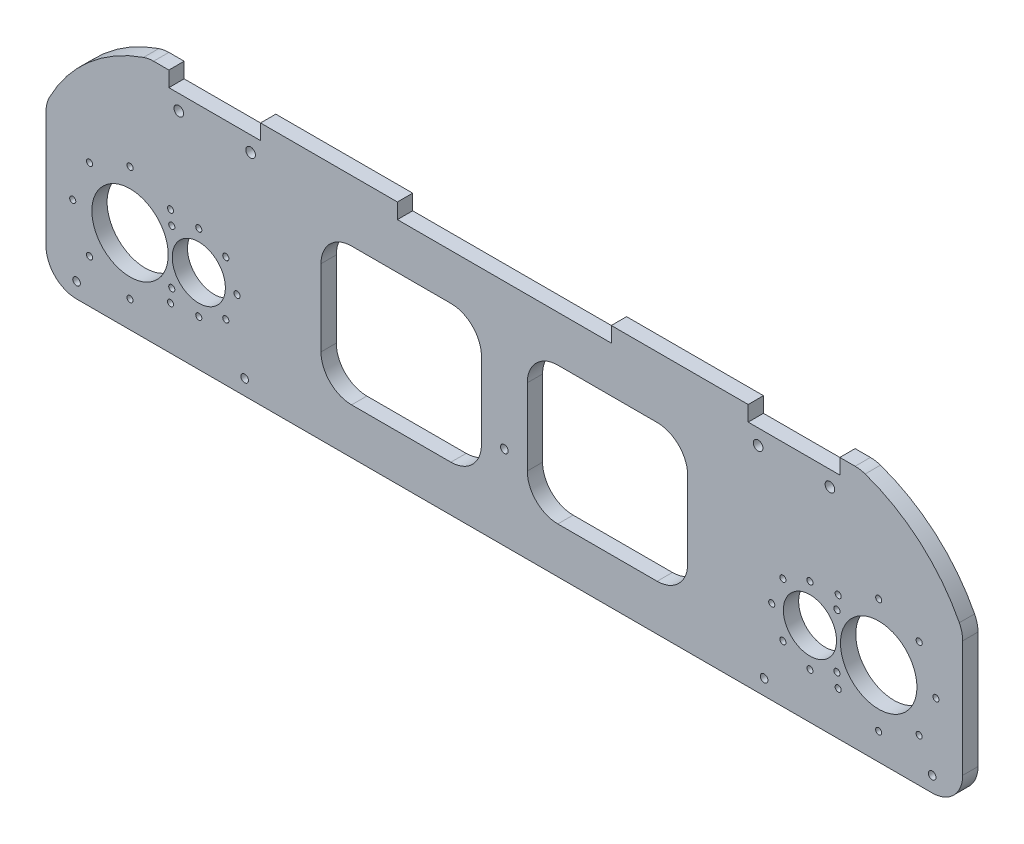
from build123d import *

# Parameters (mm, degrees)
SKETCH1_R           = 3.175
BOSS_EXTRUDE1_DEPTH = 3.175
SKETCH2_R           = 11.049
SKETCH2_R_2         = 15.875
SKETCH2_R_3         = 1.27
CUT_EXTRUDE1_DEPTH  = 202.930998425
SKETCH3_W           = 38.1
SKETCH3_H           = 6.35
SKETCH3_W_2         = 88.9
CUT_EXTRUDE4_DEPTH  = 202.930998425
CUT_EXTRUDE5_DEPTH  = 202.930998425
SKETCH5_R           = 2.003539073
CUT_EXTRUDE6_DEPTH  = 202.930998425
SKETCH6_R           = 1.5875
CUT_EXTRUDE7_DEPTH  = 202.930998425
SKETCH7_R           = 1.5875
CUT_EXTRUDE8_DEPTH  = 202.930998425


with BuildPart() as part:
    # Sketch1 → Boss-Extrude1 (new, symmetric)
    with BuildSketch(Plane.XY):
        with BuildLine():
            Line((-145.783553311, 66.675), (145.783553311, 66.675))
            ThreePointArc((145.783553311, 66.675), (147.900219978, 66.497368874), (149.957676269, 65.969444444))
            ThreePointArc((149.957676269, 65.969444444), (172.789871953, 52.74760778), (189.088888889, 31.999880883))
            ThreePointArc((189.088888889, 31.999880883), (190.142181511, 29.17513943), (190.5, 26.181720723))
            Line((190.5, 26.181720723), (190.5, -22.225))
            ThreePointArc((190.5, -22.225), (186.780256121, -31.205256121), (177.8, -34.925))
            Line((177.8, -34.925), (-177.8, -34.925))
            ThreePointArc((-177.8, -34.925), (-186.780256121, -31.205256121), (-190.5, -22.225))
            Line((-190.5, -22.225), (-190.5, 26.181720723))
            ThreePointArc((-190.5, 26.181720723), (-190.142181511, 29.17513943), (-189.088888889, 31.999880883))
            ThreePointArc((-189.088888889, 31.999880883), (-172.789871953, 52.74760778), (-149.957676269, 65.969444444))
            ThreePointArc((-149.957676269, 65.969444444), (-147.900219978, 66.497368874), (-145.783553311, 66.675))
        make_face()
        with Locations((-127, 0)):
            Circle(SKETCH1_R, mode=Mode.SUBTRACT)
        with Locations((127, 0)):
            Circle(SKETCH1_R, mode=Mode.SUBTRACT)
    extrude(amount=BOSS_EXTRUDE1_DEPTH, both=True)

    # Sketch2 → Cut-Extrude1 (cut, through all)
    with BuildSketch(Plane.XY.offset(3.175)):
        with Locations((-127, 0)):
            Circle(SKETCH2_R)
        with Locations((-155.575, 0)):
            Circle(SKETCH2_R_2)
        with Locations((-155.575, 23.8125)):
            Circle(SKETCH2_R_3)
        with Locations((-138.737019773, 16.837980227)):
            Circle(SKETCH2_R_3)
        with Locations((-138.737019773, -16.837980227)):
            Circle(SKETCH2_R_3)
        with Locations((-155.575, -23.8125)):
            Circle(SKETCH2_R_3)
        with Locations((-172.412980227, -16.837980227)):
            Circle(SKETCH2_R_3)
        with Locations((-179.3875, 0)):
            Circle(SKETCH2_R_3)
        with Locations((-172.412980227, 16.837980227)):
            Circle(SKETCH2_R_3)
        with Locations((-127, 15.875)):
            Circle(SKETCH2_R_3)
        with Locations((-115.774679849, 11.225320151)):
            Circle(SKETCH2_R_3)
        with Locations((-111.125, 0)):
            Circle(SKETCH2_R_3)
        with Locations((-115.774679849, -11.225320151)):
            Circle(SKETCH2_R_3)
        with Locations((-127, -15.875)):
            Circle(SKETCH2_R_3)
        with Locations((-138.225320151, -11.225320151)):
            Circle(SKETCH2_R_3)
        with Locations((138.225320151, 11.225320151)):
            Circle(SKETCH2_R_3)
        with Locations((-138.225320151, 11.225320151)):
            Circle(SKETCH2_R_3)
        with Locations((138.225320151, -11.225320151)):
            Circle(SKETCH2_R_3)
        with Locations((127, -15.875)):
            Circle(SKETCH2_R_3)
        with Locations((115.774679849, -11.225320151)):
            Circle(SKETCH2_R_3)
        with Locations((111.125, 0)):
            Circle(SKETCH2_R_3)
        with Locations((115.774679849, 11.225320151)):
            Circle(SKETCH2_R_3)
        with Locations((127, 15.875)):
            Circle(SKETCH2_R_3)
        with Locations((172.412980227, 16.837980227)):
            Circle(SKETCH2_R_3)
        with Locations((179.3875, 0)):
            Circle(SKETCH2_R_3)
        with Locations((172.412980227, -16.837980227)):
            Circle(SKETCH2_R_3)
        with Locations((155.575, -23.8125)):
            Circle(SKETCH2_R_3)
        with Locations((138.737019773, -16.837980227)):
            Circle(SKETCH2_R_3)
        with Locations((138.737019773, 16.837980227)):
            Circle(SKETCH2_R_3)
        with Locations((155.575, 23.8125)):
            Circle(SKETCH2_R_3)
        with Locations((155.575, 0)):
            Circle(SKETCH2_R_2)
        with Locations((127, 0)):
            Circle(SKETCH2_R)
    extrude(amount=-CUT_EXTRUDE1_DEPTH, mode=Mode.SUBTRACT)

    # Sketch3 → Cut-Extrude4 (cut, through all)
    with BuildSketch(Plane.XY.offset(3.175)):
        with Locations((-120.383553311, 63.5)):
            Rectangle(SKETCH3_W, SKETCH3_H)
        with Locations((120.383553311, 63.5)):
            Rectangle(SKETCH3_W, SKETCH3_H)
        with Locations((0, 63.5)):
            Rectangle(SKETCH3_W_2, SKETCH3_H)
    extrude(amount=-CUT_EXTRUDE4_DEPTH, mode=Mode.SUBTRACT)

    # Sketch4 → Cut-Extrude5 (cut, through all)
    with BuildSketch(Plane.XY.offset(3.175)):
        with BuildLine():
            Line((-63.5, 41.275), (-22.225, 41.275))
            ThreePointArc((-22.225, 41.275), (-13.244743879, 37.555256121), (-9.525, 28.575))
            Line((-9.525, 28.575), (-9.525, -3.175))
            ThreePointArc((-9.525, -3.175), (-13.244743879, -12.155256121), (-22.225, -15.875))
            Line((-22.225, -15.875), (-63.5, -15.875))
            ThreePointArc((-63.5, -15.875), (-72.480256121, -12.155256121), (-76.2, -3.175))
            Line((-76.2, -3.175), (-76.2, 28.575))
            ThreePointArc((-76.2, 28.575), (-72.480256121, 37.555256121), (-63.5, 41.275))
        make_face()
        with BuildLine():
            Line((76.2, 28.575), (76.2, -3.175))
            ThreePointArc((76.2, -3.175), (72.480256121, -12.155256121), (63.5, -15.875))
            Line((63.5, -15.875), (22.225, -15.875))
            ThreePointArc((22.225, -15.875), (13.244743879, -12.155256121), (9.525, -3.175))
            Line((9.525, -3.175), (9.525, 28.575))
            ThreePointArc((9.525, 28.575), (13.244743879, 37.555256121), (22.225, 41.275))
            Line((22.225, 41.275), (63.5, 41.275))
            ThreePointArc((63.5, 41.275), (72.480256121, 37.555256121), (76.2, 28.575))
        make_face()
    extrude(amount=-CUT_EXTRUDE5_DEPTH, mode=Mode.SUBTRACT)

    # Sketch5 → Cut-Extrude6 (cut, through all)
    with BuildSketch(Plane.XY.offset(3.175)):
        with Locations((-135.306053311, 53.975)):
            Circle(SKETCH5_R)
        with Locations((-105.461053311, 53.975)):
            Circle(SKETCH5_R)
        with Locations((105.461053311, 53.975)):
            Circle(SKETCH5_R)
        with Locations((135.306053311, 53.975)):
            Circle(SKETCH5_R)
    extrude(amount=-CUT_EXTRUDE6_DEPTH, mode=Mode.SUBTRACT)

    # Sketch6 → Cut-Extrude7 (cut, through all)
    with BuildSketch(Plane.XY.offset(3.175)):
        with Locations((-177.8, -28.575)):
            Circle(SKETCH6_R)
        with Locations((-107.95, -28.575)):
            Circle(SKETCH6_R)
        with Locations((107.95, -28.575)):
            Circle(SKETCH6_R)
        with Locations((177.8, -28.575)):
            Circle(SKETCH6_R)
    extrude(amount=-CUT_EXTRUDE7_DEPTH, mode=Mode.SUBTRACT)

    # Sketch7 → Cut-Extrude8 (cut, through all)
    with BuildSketch(Plane.XY.offset(3.175)):
        Circle(SKETCH7_R)
    extrude(amount=-CUT_EXTRUDE8_DEPTH, mode=Mode.SUBTRACT)


solid = part.part
